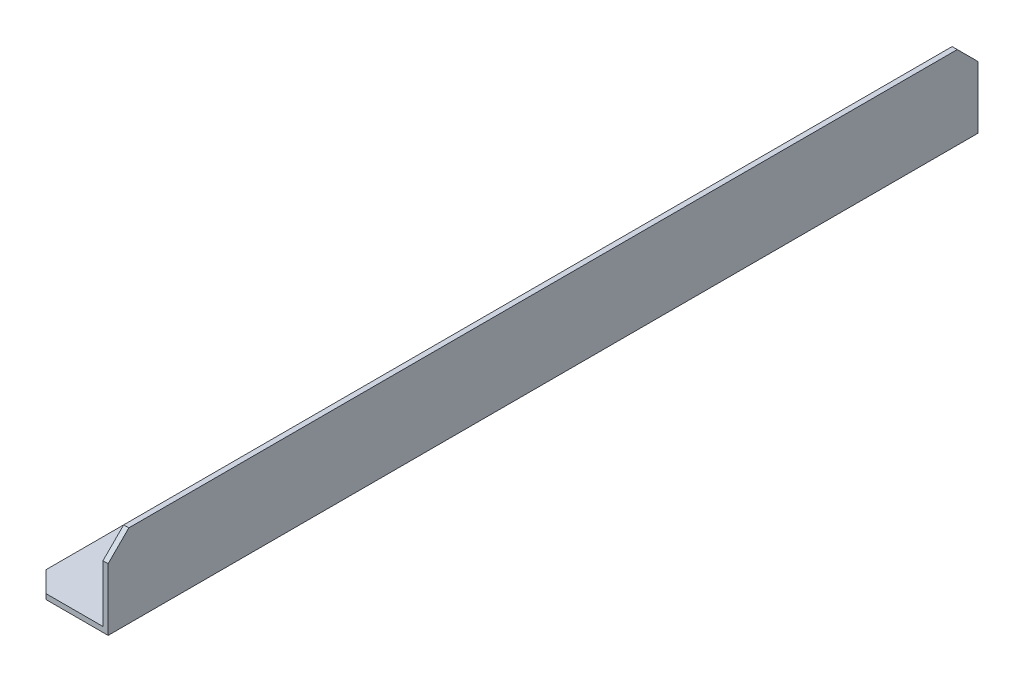
from build123d import *

# Parameters (mm, degrees)
BOSS_EXTRUDE1_DEPTH                       = 533.4
CHAMFER1_SIZE                             = 12.7
CSK_FOR_8_FLAT_HEAD_MACHINE_SCREW_2_COUNT = 2
CSK_FOR_8_FLAT_HEAD_MACHINE_SCREW_2_PITCH = 457.2
CSK_FOR_8_FLAT_HEAD_MACHINE_SCREW_3_COUNT = 2
CSK_FOR_8_FLAT_HEAD_MACHINE_SCREW_3_PITCH = 342.9
CSK_FOR_8_FLAT_HEAD_MACHINE_SCREW_4_COUNT = 2
CSK_FOR_8_FLAT_HEAD_MACHINE_SCREW_4_PITCH = 228.6
CSK_FOR_8_FLAT_HEAD_MACHINE_SCREW_5_COUNT = 2
CSK_FOR_8_FLAT_HEAD_MACHINE_SCREW_5_PITCH = 114.3


with BuildPart() as part:
    # Sketch2 → Boss-Extrude1 (new body)
    with BuildSketch(Plane.XY):
        Polygon((0, 0), (0, 50.8), (-3.175, 50.8), (-3.175, 3.175), (-50.8, 3.175), (-50.8, 0), align=None)
    extrude(amount=-BOSS_EXTRUDE1_DEPTH)

    # Chamfer1
    chamfer1_edges = [part.edges().sort_by_distance(p)[0] for p in [
        (-50.8, 1.5875, -533.4),
        (-1.5875, 50.8, -533.4),
        (-1.5875, 50.8, 0),
        (-50.8, 1.5875, 0),
    ]]
    chamfer(chamfer1_edges, length=CHAMFER1_SIZE)

    # Sketch4 → CSK for #8 Flat Head Machine Screw (100)1 (revolve, cut)
    with BuildSketch(Plane(origin=(-26.9875, 3.175, -495.3), x_dir=(0, 0, 1), z_dir=(1, 0, 0))):
        Polygon((0, 0), (0, 3.175), (2.45745, 3.175), (2.45745, 1.475934296), (4.2164, 0), align=None)
    csk_for_8_flat_head_machine_screw_100 = revolve(axis=Axis((-26.9875, 9.525, -495.3), (0, -1, 0)), mode=Mode.SUBTRACT)

    # CSK for _8 Flat Head Machine Screw _ 2: CSK for #8 Flat Head Machine Screw (100)1 ×2
    with Locations(*[(0, 0, i * CSK_FOR_8_FLAT_HEAD_MACHINE_SCREW_2_PITCH) for i in range(1, CSK_FOR_8_FLAT_HEAD_MACHINE_SCREW_2_COUNT)]):
        add(csk_for_8_flat_head_machine_screw_100, mode=Mode.SUBTRACT)

    # CSK for _8 Flat Head Machine Screw _ 3: CSK for #8 Flat Head Machine Screw (100)1 ×2
    with Locations(*[(0, 0, i * CSK_FOR_8_FLAT_HEAD_MACHINE_SCREW_3_PITCH) for i in range(1, CSK_FOR_8_FLAT_HEAD_MACHINE_SCREW_3_COUNT)]):
        add(csk_for_8_flat_head_machine_screw_100, mode=Mode.SUBTRACT)

    # CSK for _8 Flat Head Machine Screw _ 4: CSK for #8 Flat Head Machine Screw (100)1 ×2
    with Locations(*[(0, 0, i * CSK_FOR_8_FLAT_HEAD_MACHINE_SCREW_4_PITCH) for i in range(1, CSK_FOR_8_FLAT_HEAD_MACHINE_SCREW_4_COUNT)]):
        add(csk_for_8_flat_head_machine_screw_100, mode=Mode.SUBTRACT)

    # CSK for _8 Flat Head Machine Screw _ 5: CSK for #8 Flat Head Machine Screw (100)1 ×2
    with Locations(*[(0, 0, i * CSK_FOR_8_FLAT_HEAD_MACHINE_SCREW_5_PITCH) for i in range(1, CSK_FOR_8_FLAT_HEAD_MACHINE_SCREW_5_COUNT)]):
        add(csk_for_8_flat_head_machine_screw_100, mode=Mode.SUBTRACT)


solid = part.part
